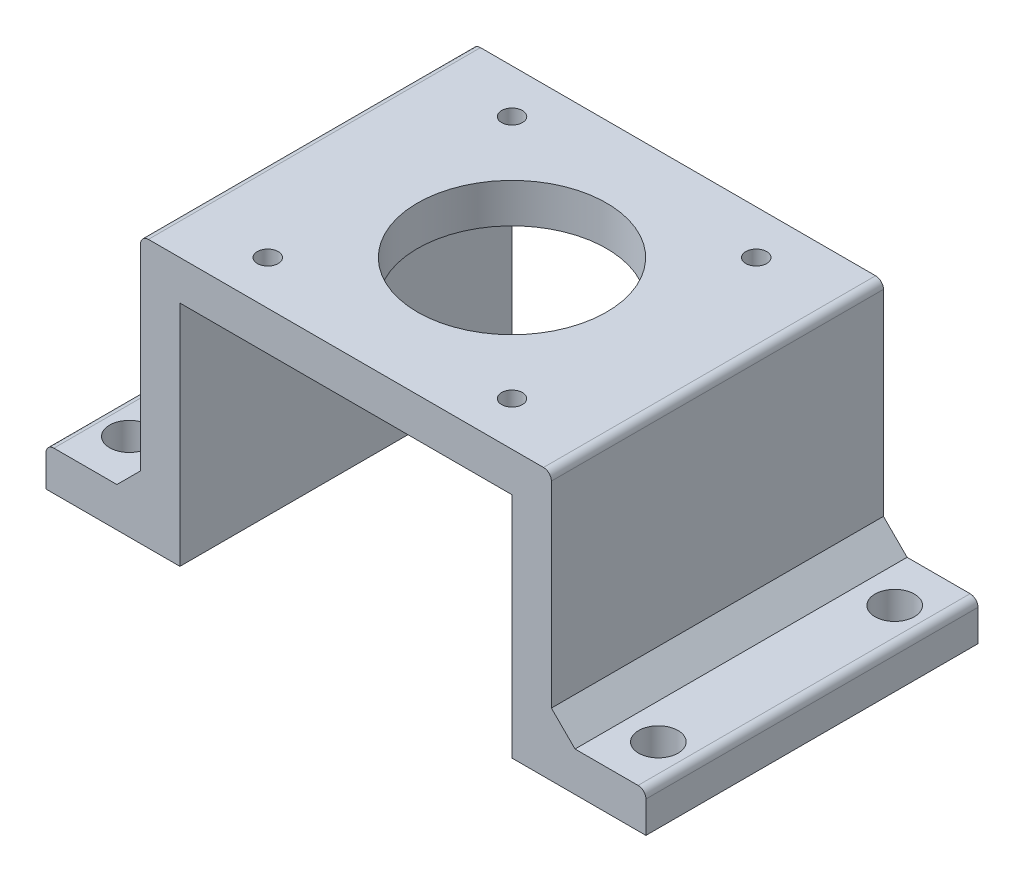
from build123d import *

# Parameters (mm, degrees)
ESQUISSE1_W                  = 42.15
ESQUISSE1_H                  = 42.15
BOSS_EXTRU_1_DEPTH           = 5
ESQUISSE2_R                  = 1.325
ENL_V_MAT_EXTRU_1_DEPTH      = 31.221039856
ESQUISSE3_R                  = 12
ENL_V_MAT_EXTRU_2_DEPTH      = 31.221039856
ESQUISSE4_W                  = 42.15
ESQUISSE4_H                  = 33.95
BOSS_EXTRU_2_DEPTH           = 5
ESQUISSE5_W                  = 42.15
ESQUISSE5_H                  = 5
BOSS_EXTRU_3_DEPTH           = 12
ESQUISSE7_R                  = 2.5
ENL_V_MAT_EXTRU_3_DEPTH      = 53.268190613
CONG_2_R                     = 1
CHANFREIN1_SIZE              = 3
CONG_2_OF_SYM_TRIE3_R        = 1
CHANFREIN1_OF_SYM_TRIE3_SIZE = 3


with BuildPart() as part:
    # Esquisse1 → Boss.-Extru.1 (new body)
    with BuildSketch(Plane(origin=(0, 0, 0), x_dir=(1, 0, 0), z_dir=(0, 1, 0))):
        Rectangle(ESQUISSE1_W, ESQUISSE1_H)
    extrude(amount=BOSS_EXTRU_1_DEPTH)

    # Esquisse2 → Enlèv. mat.-Extru.1 (cut, through all)
    with BuildSketch(Plane(origin=(0, 5, 0), x_dir=(1, 0, 0), z_dir=(0, 1, 0))):
        with Locations((-15.5, 15.5)):
            Circle(ESQUISSE2_R)
        with Locations((15.5, 15.5)):
            Circle(ESQUISSE2_R)
    enl_v_mat_extru_1 = extrude(amount=-ENL_V_MAT_EXTRU_1_DEPTH, mode=Mode.SUBTRACT)

    # Symétrie1: Enlèv. mat.-Extru.1 across plane
    add(enl_v_mat_extru_1.mirror(Plane.XY), mode=Mode.SUBTRACT)

    # Esquisse3 → Enlèv. mat.-Extru.2 (cut, through all)
    with BuildSketch(Plane(origin=(0, 5, 0), x_dir=(1, 0, 0), z_dir=(0, 1, 0))):
        Circle(ESQUISSE3_R)
    extrude(amount=-ENL_V_MAT_EXTRU_2_DEPTH, mode=Mode.SUBTRACT)

    # Esquisse4 → Boss.-Extru.2 (add)
    with BuildSketch(Plane(origin=(21.075, 0, 0), x_dir=(0, 0, -1), z_dir=(1, 0, 0))):
        with Locations((0, -11.975)):
            Rectangle(ESQUISSE4_W, ESQUISSE4_H)
    boss_extru_2 = extrude(amount=BOSS_EXTRU_2_DEPTH)

    # Esquisse5 → Boss.-Extru.3 (add)
    with BuildSketch(Plane(origin=(26.075, 0, 0), x_dir=(0, 0, -1), z_dir=(1, 0, 0))):
        with Locations((0, -26.45)):
            Rectangle(ESQUISSE5_W, ESQUISSE5_H)
    boss_extru_3 = extrude(amount=BOSS_EXTRU_3_DEPTH)

    # Esquisse7 → Enlèv. mat.-Extru.3 (cut, through all)
    with BuildSketch(Plane(origin=(0, -23.95, 0), x_dir=(1, 0, 0), z_dir=(0, 1, 0))):
        with Locations((33.575, 15)):
            Circle(ESQUISSE7_R)
        with Locations((33.575, -15)):
            Circle(ESQUISSE7_R)
    enl_v_mat_extru_3 = extrude(amount=-ENL_V_MAT_EXTRU_3_DEPTH, mode=Mode.SUBTRACT)

    # Congé2
    cong_2_edges = [part.edges().sort_by_distance(p)[0] for p in [
        (38.075, -23.95, 0),
        (26.075, 5, 0),
    ]]
    fillet(cong_2_edges, radius=CONG_2_R)

    # Chanfrein1
    chanfrein1_edges = [part.edges().sort_by_distance(p)[0] for p in [
        (26.075, -23.95, 0),
    ]]
    chamfer(chanfrein1_edges, length=CHANFREIN1_SIZE)

    # Symétrie3: Boss.-Extru.2, Boss.-Extru.3, Enlèv. mat.-Extru.3 across plane
    add(boss_extru_2.mirror(Plane(origin=(0, 0, 0), x_dir=(0, 0, 1), z_dir=(1, 0, 0))))
    add(boss_extru_3.mirror(Plane(origin=(0, 0, 0), x_dir=(0, 0, 1), z_dir=(1, 0, 0))))
    add(enl_v_mat_extru_3.mirror(Plane(origin=(0, 0, 0), x_dir=(0, 0, 1), z_dir=(1, 0, 0))), mode=Mode.SUBTRACT)

    # Congé2 of Symétrie3
    cong_2_of_sym_trie3_edges = [part.edges().sort_by_distance(p)[0] for p in [
        (-38.075, -23.95, 0),
        (-26.075, 5, 0),
    ]]
    fillet(cong_2_of_sym_trie3_edges, radius=CONG_2_OF_SYM_TRIE3_R)

    # Chanfrein1 of Symétrie3
    chanfrein1_of_sym_trie3_edges = [part.edges().sort_by_distance(p)[0] for p in [
        (-26.075, -23.95, 0),
    ]]
    chamfer(chanfrein1_of_sym_trie3_edges, length=CHANFREIN1_OF_SYM_TRIE3_SIZE)


solid = part.part
